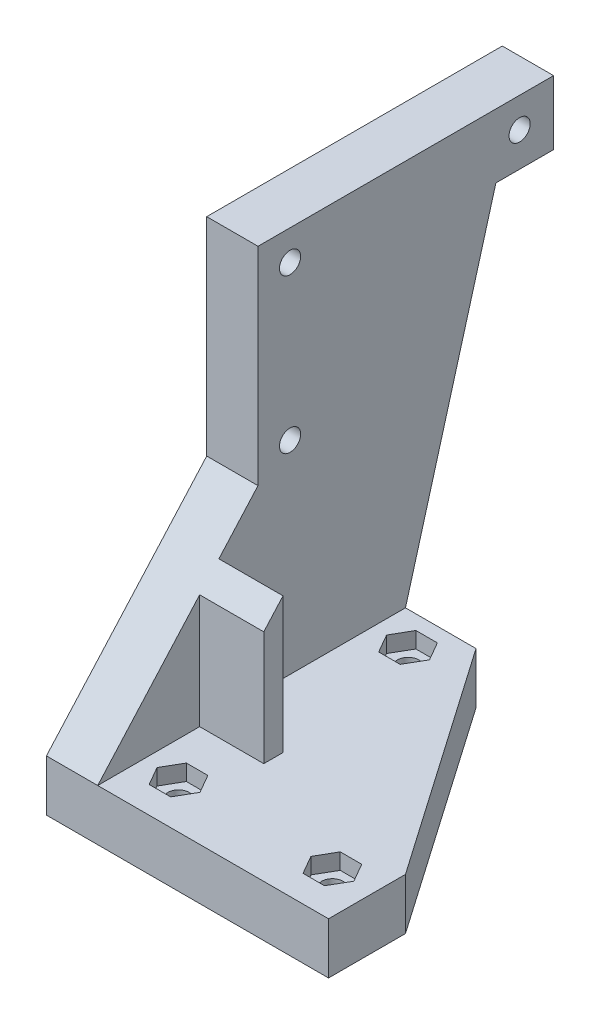
from build123d import *

# Parameters (mm, degrees)
SKETCH1_R           = 1.65
BOSS_EXTRUDE1_DEPTH = 8
SKETCH3_R           = 1.65
BOSS_EXTRUDE2_DEPTH = 8
CUT_EXTRUDE1_DEPTH  = 2.5
BOSS_EXTRUDE3_DEPTH = 10


with BuildPart() as part:
    # Sketch1 → Boss-Extrude1 (new body)
    with BuildSketch(Plane(origin=(0, 0, 0), x_dir=(1, 0, 0), z_dir=(0, 1, 0))):
        Polygon((-30.201635745, 21.458760302), (-19.201635745, 21.458760302), (5.798364255, -14.541239698), (5.798364255, -26.541239698), (-30.201635745, -26.541239698), align=None)
        with Locations((-24.651635745, 16.308760302)):
            Circle(SKETCH1_R, mode=Mode.SUBTRACT)
        with Locations((-24.651635745, -19.491239698)):
            Circle(SKETCH1_R, mode=Mode.SUBTRACT)
        with Locations((-0.651635745, -19.491239698)):
            Circle(SKETCH1_R, mode=Mode.SUBTRACT)
    extrude(amount=BOSS_EXTRUDE1_DEPTH)

    # Sketch3 → Boss-Extrude2 (add)
    with BuildSketch(Plane.ZY.offset(30.201635745)):
        Polygon((-44.558757353, 58.334529743), (-35.558757353, 58.334529743), (-21.458760302, 8), (-21.458760302, 0), (26.541239698, 0), (26.541239698, 8), (1.541239698, 36), (1.541239698, 68.334529743), (-44.558757353, 68.334529743), align=None)
        with Locations((-3.458760302, 39.65)):
            Circle(SKETCH3_R, mode=Mode.SUBTRACT)
        with Locations((-3.458760302, 63.65)):
            Circle(SKETCH3_R, mode=Mode.SUBTRACT)
        with Locations((-39.258757353, 63.664529743)):
            Circle(SKETCH3_R, mode=Mode.SUBTRACT)
    extrude(amount=BOSS_EXTRUDE2_DEPTH)

    # Sketch4 → Cut-Extrude1 (cut)
    with BuildSketch(Plane(origin=(0, 8, 0), x_dir=(1, 0, 0), z_dir=(0, 1, 0))):
        Polygon((-26.326635745, 13.407575199), (-22.976635745, 13.407575199), (-21.301635745, 16.308760302), (-22.976635745, 19.209945405), (-26.326635745, 19.209945405), (-28.001635745, 16.308760302), align=None)
        Polygon((-22.976635745, -16.590054595), (-26.326635745, -16.590054595), (-28.001635745, -19.491239698), (-26.326635745, -22.392424801), (-22.976635745, -22.392424801), (-21.301635745, -19.491239698), align=None)
        Polygon((1.023364255, -16.590054595), (-2.326635745, -16.590054595), (-4.001635745, -19.491239698), (-2.326635745, -22.392424801), (1.023364255, -22.392424801), (2.698364255, -19.491239698), align=None)
    extrude(amount=-CUT_EXTRUDE1_DEPTH, mode=Mode.SUBTRACT)

    # Sketch5 → Boss-Extrude3 (add)
    with BuildSketch(Plane(origin=(-30.201635745, 0, 0), x_dir=(0, 0, -1), z_dir=(1, 0, 0))):
        Polygon((-10.641239698, 8), (-7.641239698, 8), (-7.641239698, 29.168), (-10.641239698, 25.808), align=None)
    extrude(amount=BOSS_EXTRUDE3_DEPTH)


solid = part.part
